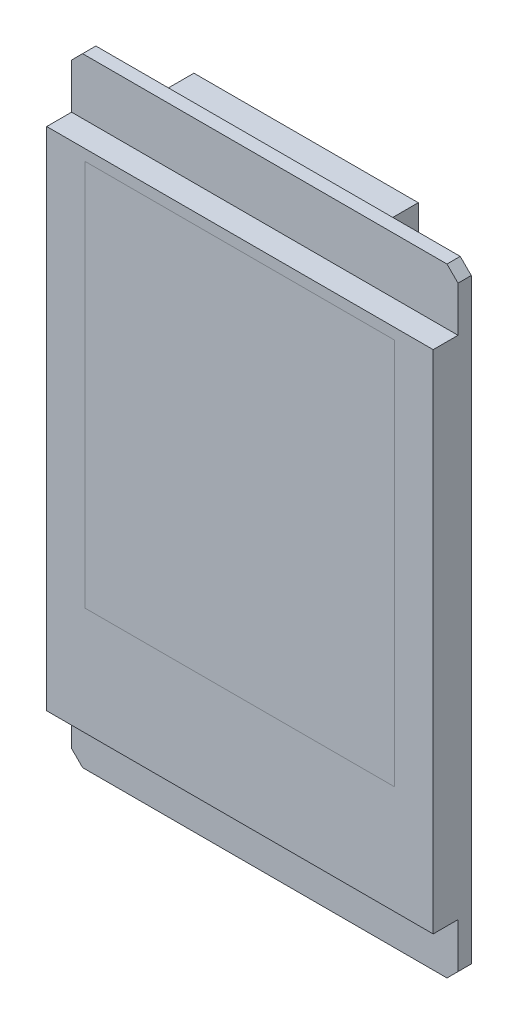
from build123d import *

# Parameters (mm, degrees)
EXTRUDE_1_DEPTH = 1.2
SKETCH_2_W      = 35
SKETCH_2_H      = 45.83
EXTRUDE_2_DEPTH = 2.25
SKETCH_4_W      = 20.32
SKETCH_4_H      = 2.54
EXTRUDE_3_DEPTH = 2.54


with BuildPart() as part:
    # 草图1 → 凸台-拉伸1 (new body)
    with BuildSketch(Plane.XY):
        Polygon((0, 55), (1, 56), (34, 56), (35, 55), (35, 1), (34, 0), (1, 0), (0, 1), align=None)
    extrude(amount=EXTRUDE_1_DEPTH)

    # 草图2 → 凸台-拉伸2 (add)
    with BuildSketch(Plane.XY.offset(1.2)):
        with Locations((17.5, 27.995)):
            Rectangle(SKETCH_2_W, SKETCH_2_H)
    extrude(amount=EXTRUDE_2_DEPTH)

    # 草图4 → 凸台-拉伸3 (add)
    with BuildSketch(Plane(origin=(0, 0, 0), x_dir=(-1, 0, 0), z_dir=(0, 0, -1))):
        with Locations((-17.5, 54.5)):
            Rectangle(SKETCH_4_W, SKETCH_4_H)
    extrude(amount=EXTRUDE_3_DEPTH)


solid = part.part
